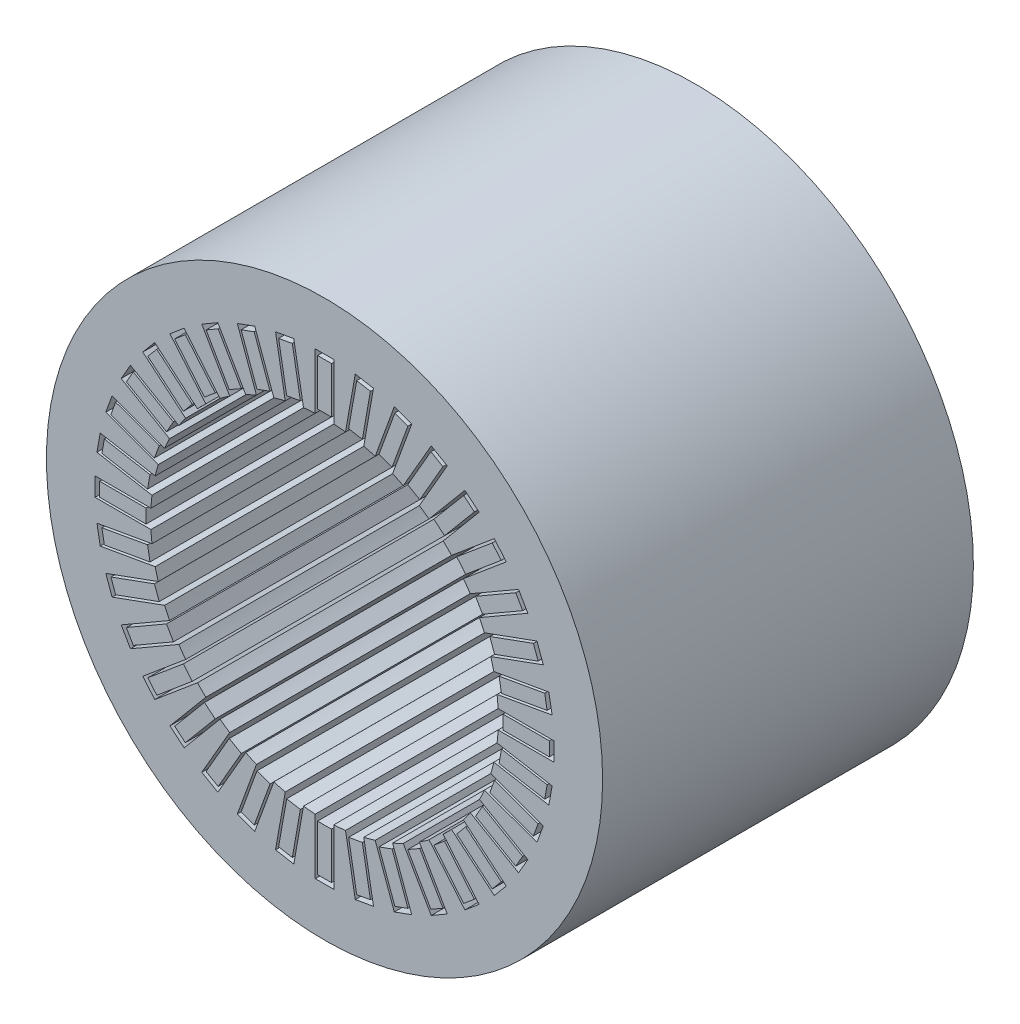
from build123d import *

# Parameters (mm, degrees)
SKETCH1_R         = 60
SKETCH1_R_2       = 37.5
NUCLEO_DEPTH      = 80
SKETCH5_W         = 12.5
SKETCH5_H         = 4
RANURA_DEPTH      = 117.619037897
RANURAS_X36_COUNT = 36
SKETCH6_W         = 10
SKETCH6_H         = 3
BOBINA_DEPTH      = 80
BOBINAS_X36_COUNT = 36


with BuildPart() as part:
    # Sketch1 → Nucleo (new body)
    with BuildSketch(Plane.XY):
        Circle(SKETCH1_R)
        Circle(SKETCH1_R_2, mode=Mode.SUBTRACT)
    extrude(amount=NUCLEO_DEPTH)

    # Sketch5 → Ranura (cut, through all)
    with BuildSketch(Plane.XY):
        with Locations((43.25, 0)):
            Rectangle(SKETCH5_W, SKETCH5_H)
    ranura = extrude(amount=RANURA_DEPTH, mode=Mode.SUBTRACT)

    # Ranuras_x36: Ranura ×36 about axis
    ranuras_x36_axis = Axis((0, 0, -4), (0, 0, 1))
    for i in range(1, RANURAS_X36_COUNT):
        add(ranura.rotate(ranuras_x36_axis, i * 360 / RANURAS_X36_COUNT), mode=Mode.SUBTRACT)


with BuildPart() as body_2:
    # Sketch6 → Bobina (new body)
    with BuildSketch(Plane.XY):
        with Locations((43.5, 0)):
            Rectangle(SKETCH6_W, SKETCH6_H)
    extrude(amount=BOBINA_DEPTH)


with BuildPart() as bobinas_x36_1:
    # Bobinas_x36: pattern copy
    add(body_2.part.rotate(Axis((0, 0, -4), (0, 0, 1)), 1 * 360 / BOBINAS_X36_COUNT))


with BuildPart() as bobinas_x36_2:
    # Bobinas_x36: pattern copy
    add(body_2.part.rotate(Axis((0, 0, -4), (0, 0, 1)), 2 * 360 / BOBINAS_X36_COUNT))


with BuildPart() as bobinas_x36_3:
    # Bobinas_x36: pattern copy
    add(body_2.part.rotate(Axis((0, 0, -4), (0, 0, 1)), 3 * 360 / BOBINAS_X36_COUNT))


with BuildPart() as bobinas_x36_4:
    # Bobinas_x36: pattern copy
    add(body_2.part.rotate(Axis((0, 0, -4), (0, 0, 1)), 4 * 360 / BOBINAS_X36_COUNT))


with BuildPart() as bobinas_x36_5:
    # Bobinas_x36: pattern copy
    add(body_2.part.rotate(Axis((0, 0, -4), (0, 0, 1)), 5 * 360 / BOBINAS_X36_COUNT))


with BuildPart() as bobinas_x36_6:
    # Bobinas_x36: pattern copy
    add(body_2.part.rotate(Axis((0, 0, -4), (0, 0, 1)), 6 * 360 / BOBINAS_X36_COUNT))


with BuildPart() as bobinas_x36_7:
    # Bobinas_x36: pattern copy
    add(body_2.part.rotate(Axis((0, 0, -4), (0, 0, 1)), 7 * 360 / BOBINAS_X36_COUNT))


with BuildPart() as bobinas_x36_8:
    # Bobinas_x36: pattern copy
    add(body_2.part.rotate(Axis((0, 0, -4), (0, 0, 1)), 8 * 360 / BOBINAS_X36_COUNT))


with BuildPart() as bobinas_x36_9:
    # Bobinas_x36: pattern copy
    add(body_2.part.rotate(Axis((0, 0, -4), (0, 0, 1)), 9 * 360 / BOBINAS_X36_COUNT))


with BuildPart() as bobinas_x36_10:
    # Bobinas_x36: pattern copy
    add(body_2.part.rotate(Axis((0, 0, -4), (0, 0, 1)), 10 * 360 / BOBINAS_X36_COUNT))


with BuildPart() as bobinas_x36_11:
    # Bobinas_x36: pattern copy
    add(body_2.part.rotate(Axis((0, 0, -4), (0, 0, 1)), 11 * 360 / BOBINAS_X36_COUNT))


with BuildPart() as bobinas_x36_12:
    # Bobinas_x36: pattern copy
    add(body_2.part.rotate(Axis((0, 0, -4), (0, 0, 1)), 12 * 360 / BOBINAS_X36_COUNT))


with BuildPart() as bobinas_x36_13:
    # Bobinas_x36: pattern copy
    add(body_2.part.rotate(Axis((0, 0, -4), (0, 0, 1)), 13 * 360 / BOBINAS_X36_COUNT))


with BuildPart() as bobinas_x36_14:
    # Bobinas_x36: pattern copy
    add(body_2.part.rotate(Axis((0, 0, -4), (0, 0, 1)), 14 * 360 / BOBINAS_X36_COUNT))


with BuildPart() as bobinas_x36_15:
    # Bobinas_x36: pattern copy
    add(body_2.part.rotate(Axis((0, 0, -4), (0, 0, 1)), 15 * 360 / BOBINAS_X36_COUNT))


with BuildPart() as bobinas_x36_16:
    # Bobinas_x36: pattern copy
    add(body_2.part.rotate(Axis((0, 0, -4), (0, 0, 1)), 16 * 360 / BOBINAS_X36_COUNT))


with BuildPart() as bobinas_x36_17:
    # Bobinas_x36: pattern copy
    add(body_2.part.rotate(Axis((0, 0, -4), (0, 0, 1)), 17 * 360 / BOBINAS_X36_COUNT))


with BuildPart() as bobinas_x36_18:
    # Bobinas_x36: pattern copy
    add(body_2.part.rotate(Axis((0, 0, -4), (0, 0, 1)), 18 * 360 / BOBINAS_X36_COUNT))


with BuildPart() as bobinas_x36_19:
    # Bobinas_x36: pattern copy
    add(body_2.part.rotate(Axis((0, 0, -4), (0, 0, 1)), 19 * 360 / BOBINAS_X36_COUNT))


with BuildPart() as bobinas_x36_20:
    # Bobinas_x36: pattern copy
    add(body_2.part.rotate(Axis((0, 0, -4), (0, 0, 1)), 20 * 360 / BOBINAS_X36_COUNT))


with BuildPart() as bobinas_x36_21:
    # Bobinas_x36: pattern copy
    add(body_2.part.rotate(Axis((0, 0, -4), (0, 0, 1)), 21 * 360 / BOBINAS_X36_COUNT))


with BuildPart() as bobinas_x36_22:
    # Bobinas_x36: pattern copy
    add(body_2.part.rotate(Axis((0, 0, -4), (0, 0, 1)), 22 * 360 / BOBINAS_X36_COUNT))


with BuildPart() as bobinas_x36_23:
    # Bobinas_x36: pattern copy
    add(body_2.part.rotate(Axis((0, 0, -4), (0, 0, 1)), 23 * 360 / BOBINAS_X36_COUNT))


with BuildPart() as bobinas_x36_24:
    # Bobinas_x36: pattern copy
    add(body_2.part.rotate(Axis((0, 0, -4), (0, 0, 1)), 24 * 360 / BOBINAS_X36_COUNT))


with BuildPart() as bobinas_x36_25:
    # Bobinas_x36: pattern copy
    add(body_2.part.rotate(Axis((0, 0, -4), (0, 0, 1)), 25 * 360 / BOBINAS_X36_COUNT))


with BuildPart() as bobinas_x36_26:
    # Bobinas_x36: pattern copy
    add(body_2.part.rotate(Axis((0, 0, -4), (0, 0, 1)), 26 * 360 / BOBINAS_X36_COUNT))


with BuildPart() as bobinas_x36_27:
    # Bobinas_x36: pattern copy
    add(body_2.part.rotate(Axis((0, 0, -4), (0, 0, 1)), 27 * 360 / BOBINAS_X36_COUNT))


with BuildPart() as bobinas_x36_28:
    # Bobinas_x36: pattern copy
    add(body_2.part.rotate(Axis((0, 0, -4), (0, 0, 1)), 28 * 360 / BOBINAS_X36_COUNT))


with BuildPart() as bobinas_x36_29:
    # Bobinas_x36: pattern copy
    add(body_2.part.rotate(Axis((0, 0, -4), (0, 0, 1)), 29 * 360 / BOBINAS_X36_COUNT))


with BuildPart() as bobinas_x36_30:
    # Bobinas_x36: pattern copy
    add(body_2.part.rotate(Axis((0, 0, -4), (0, 0, 1)), 30 * 360 / BOBINAS_X36_COUNT))


with BuildPart() as bobinas_x36_31:
    # Bobinas_x36: pattern copy
    add(body_2.part.rotate(Axis((0, 0, -4), (0, 0, 1)), 31 * 360 / BOBINAS_X36_COUNT))


with BuildPart() as bobinas_x36_32:
    # Bobinas_x36: pattern copy
    add(body_2.part.rotate(Axis((0, 0, -4), (0, 0, 1)), 32 * 360 / BOBINAS_X36_COUNT))


with BuildPart() as bobinas_x36_33:
    # Bobinas_x36: pattern copy
    add(body_2.part.rotate(Axis((0, 0, -4), (0, 0, 1)), 33 * 360 / BOBINAS_X36_COUNT))


with BuildPart() as bobinas_x36_34:
    # Bobinas_x36: pattern copy
    add(body_2.part.rotate(Axis((0, 0, -4), (0, 0, 1)), 34 * 360 / BOBINAS_X36_COUNT))


with BuildPart() as bobinas_x36_35:
    # Bobinas_x36: pattern copy
    add(body_2.part.rotate(Axis((0, 0, -4), (0, 0, 1)), 35 * 360 / BOBINAS_X36_COUNT))


solid = Compound([part.part, body_2.part, bobinas_x36_1.part, bobinas_x36_2.part, bobinas_x36_3.part, bobinas_x36_4.part, bobinas_x36_5.part, bobinas_x36_6.part, bobinas_x36_7.part, bobinas_x36_8.part, bobinas_x36_9.part, bobinas_x36_10.part, bobinas_x36_11.part, bobinas_x36_12.part, bobinas_x36_13.part, bobinas_x36_14.part, bobinas_x36_15.part, bobinas_x36_16.part, bobinas_x36_17.part, bobinas_x36_18.part, bobinas_x36_19.part, bobinas_x36_20.part, bobinas_x36_21.part, bobinas_x36_22.part, bobinas_x36_23.part, bobinas_x36_24.part, bobinas_x36_25.part, bobinas_x36_26.part, bobinas_x36_27.part, bobinas_x36_28.part, bobinas_x36_29.part, bobinas_x36_30.part, bobinas_x36_31.part, bobinas_x36_32.part, bobinas_x36_33.part, bobinas_x36_34.part, bobinas_x36_35.part])
